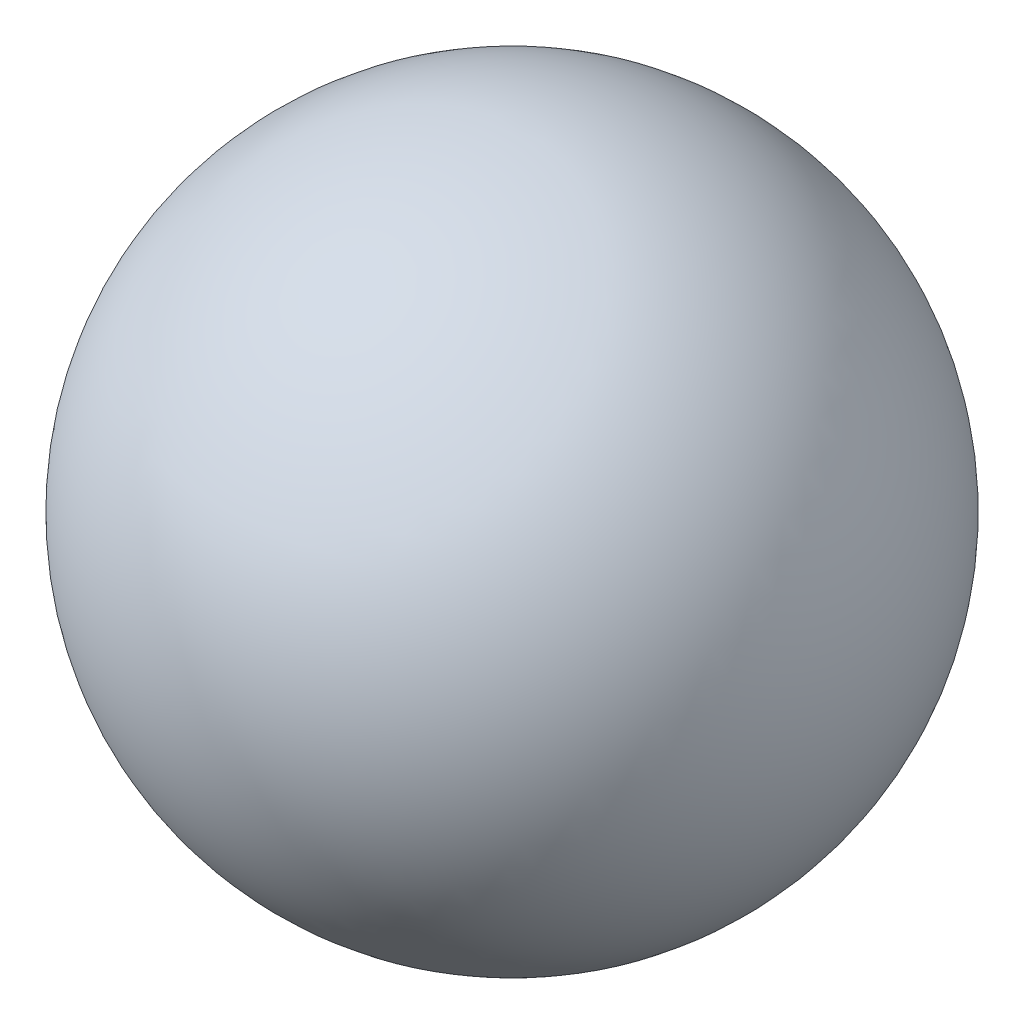
from build123d import *


with BuildPart() as part:
    # Sketch2 → Revolve1 (revolve)
    with BuildSketch(Plane(origin=(0, 0, 0), x_dir=(0, 0, -1), z_dir=(1, 0, 0))):
        with BuildLine():
            Line((0, 2.16), (0, -2.16))
            ThreePointArc((0, -2.16), (2.16, 0), (0, 2.16))
        make_face()
    revolve(axis=Axis((0, -2.16, 0), (0, 1, 0)))


solid = part.part
